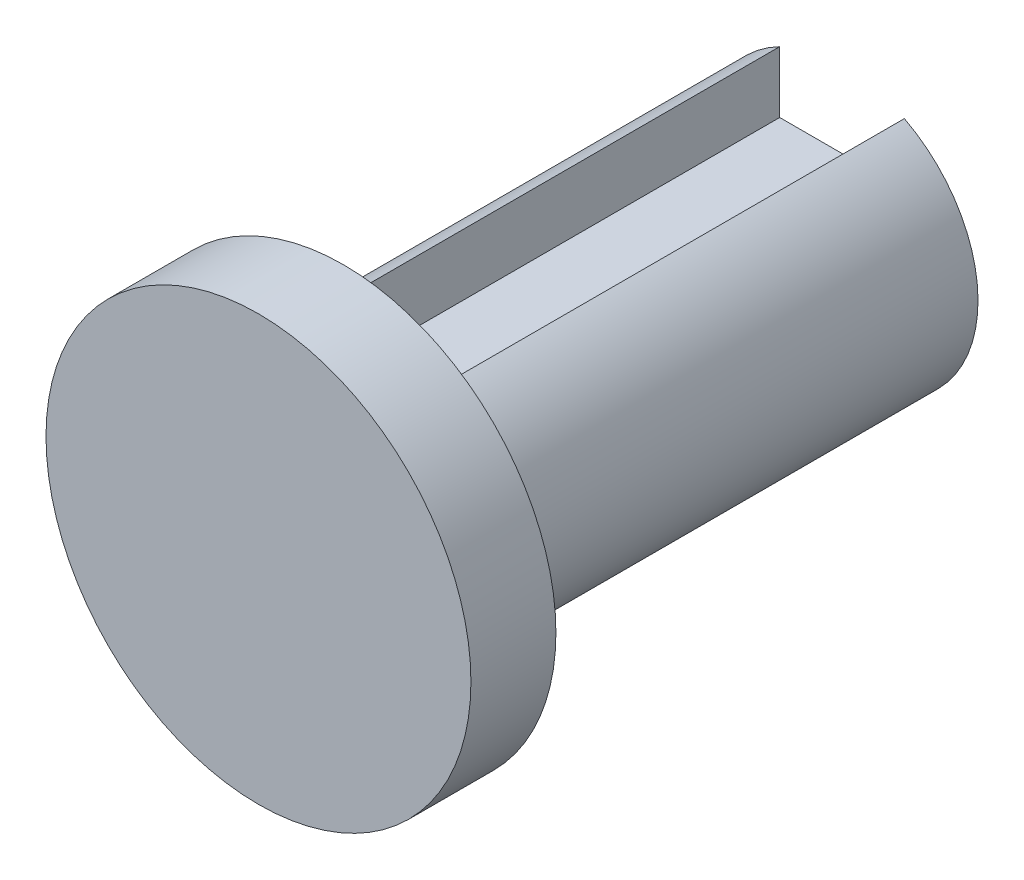
from build123d import *

# Parameters (mm, degrees)
SKETCH1_R           = 15
BOSS_EXTRUDE1_DEPTH = 6
BOSS_EXTRUDE2_DEPTH = 35.2


with BuildPart() as part:
    # Sketch1 → Boss-Extrude1 (new body)
    with BuildSketch(Plane.XY):
        Circle(SKETCH1_R)
    extrude(amount=BOSS_EXTRUDE1_DEPTH)

    # Sketch1<3> → Boss-Extrude2 (add)
    with BuildSketch(Plane.XY):
        with BuildLine():
            Line((4.4, 8.532291603), (4.4, 4.2))
            Line((4.4, 4.2), (-4.4, 4.2))
            Line((-4.4, 4.2), (-4.4, 8.532291603))
            ThreePointArc((-4.4, 8.532291603), (-4.995998399, -8.197560613), (9.6, 0))
            ThreePointArc((9.6, 0), (8.197560613, 4.995998399), (4.4, 8.532291603))
        make_face()
    extrude(amount=-BOSS_EXTRUDE2_DEPTH)


solid = part.part
